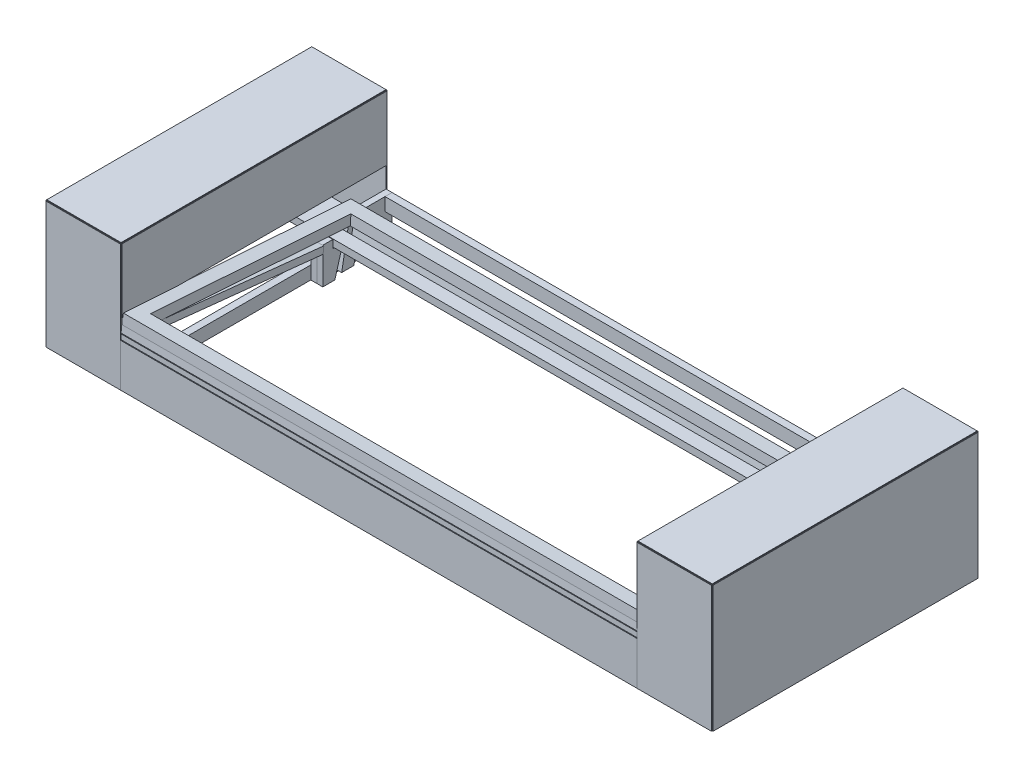
from build123d import *

# Parameters (mm, degrees)
SKETCH1_W              = 22.225
SKETCH1_H              = 41.275
BOSS_EXTRUDE1_DEPTH    = 838.2
SKETCH1_W_2            = 41.275
SKETCH1_H_2            = 22.225
BOSS_EXTRUDE1_2_DEPTH  = 838.2
BOSS_EXTRUDE1_3_DEPTH  = 838.2
BOSS_EXTRUDE1_4_DEPTH  = 838.2
BOSS_EXTRUDE1_5_DEPTH  = 838.2
BOSS_EXTRUDE1_6_DEPTH  = 838.2
BOSS_EXTRUDE1_7_DEPTH  = 838.2
SKETCH1_3_W            = 234.95
SKETCH1_3_H            = 2.54
EXTRUDE_THIN1_DEPTH    = 838.2
SKETCH1_4_W            = 2.54
SKETCH1_4_H            = 400.05
EXTRUDE_THIN2_DEPTH    = 838.2
SKETCH1_5_W            = 2.54
SKETCH1_5_H            = 203.2
EXTRUDE_THIN3_DEPTH    = 838.2
BOSS_EXTRUDE2_DEPTH    = 22.225
SKETCH3_W              = 74.6125
SKETCH3_H              = 41.275
BOSS_EXTRUDE3_DEPTH    = 22.225
BOSS_EXTRUDE3_2_DEPTH  = 22.225
BOSS_EXTRUDE3_3_DEPTH  = 22.225
BOSS_EXTRUDE3_4_DEPTH  = 22.225
SKETCH4_W              = 190.5
SKETCH4_H              = 111.125
BOSS_EXTRUDE4_DEPTH    = 22.225
BOSS_EXTRUDE4_2_DEPTH  = 22.225
EXTRUDE_THIN4_START    = -400.05
SKETCH4_3_W            = 234.95
SKETCH4_3_H            = 2.54
EXTRUDE_THIN4_DEPTH    = 400.05
SKETCH4_4_W            = 234.95
SKETCH4_4_H            = 2.54
EXTRUDE_THIN5_DEPTH    = 400.05
BOSS_EXTRUDE6_DEPTH    = 19.05
BOSS_EXTRUDE7_START    = 19.05
BOSS_EXTRUDE7_DEPTH    = 19.05
BOSS_EXTRUDE9_START    = 19.05
BOSS_EXTRUDE9_DEPTH    = 1597.025
SKETCH5_4_W            = 41.275
SKETCH5_4_H            = 22.225
BOSS_EXTRUDE9_2_DEPTH  = 1597.025
SKETCH5_4_W_2          = 22.225
SKETCH5_4_H_2          = 41.275
BOSS_EXTRUDE9_3_DEPTH  = 1597.025
BOSS_EXTRUDE9_4_DEPTH  = 1597.025
BOSS_EXTRUDE10_START   = 38.1
BOSS_EXTRUDE10_DEPTH   = 1558.925
BOSS_EXTRUDE11_DEPTH   = 1635.125
BOSS_EXTRUDE11_2_DEPTH = 1635.125
BOSS_EXTRUDE11_3_DEPTH = 1635.125
SKETCH5_8_W            = 22.225
SKETCH5_8_H            = 28.575
BOSS_EXTRUDE13_DEPTH   = 41.275
SKETCH5_9_W            = 2.54
SKETCH5_9_H            = 136.525
EXTRUDE_THIN6_DEPTH    = 1635.125
BOSS_EXTRUDE14_DEPTH   = 41.275
BOSS_EXTRUDE15_DEPTH   = 44.45
SKETCH7_W              = 1546.225
SKETCH7_H              = 44.45
BOSS_EXTRUDE16_DEPTH   = 31.824813128


with BuildPart() as part:
    # Sketch1 → Boss-Extrude1 (new body)
    with BuildSketch(Plane.XY):
        with Locations((-1041.4, 379.4125)):
            Rectangle(SKETCH1_W, SKETCH1_H)
    extrude(amount=BOSS_EXTRUDE1_DEPTH)


with BuildPart() as body_2:
    # Sketch1 → Boss-Extrude1 2 (new body)
    with BuildSketch(Plane.XY):
        with Locations((-935.0375, 388.9375)):
            Rectangle(SKETCH1_W_2, SKETCH1_H_2)
    extrude(amount=BOSS_EXTRUDE1_2_DEPTH)


with BuildPart() as body_3:
    # Sketch1 → Boss-Extrude1 3 (new body)
    with BuildSketch(Plane.XY):
        with Locations((-828.675, 379.4125)):
            Rectangle(SKETCH1_W, SKETCH1_H)
    extrude(amount=BOSS_EXTRUDE1_3_DEPTH)


with BuildPart() as body_4:
    # Sketch1 → Boss-Extrude1 4 (new body)
    with BuildSketch(Plane.XY):
        with Locations((-828.675, 207.9625)):
            Rectangle(SKETCH1_W, SKETCH1_H_2)
    extrude(amount=BOSS_EXTRUDE1_4_DEPTH)


with BuildPart() as body_5:
    # Sketch1 → Boss-Extrude1 5 (new body)
    with BuildSketch(Plane.XY):
        with Locations((-828.675, 20.6375)):
            Rectangle(SKETCH1_W, SKETCH1_H)
    extrude(amount=BOSS_EXTRUDE1_5_DEPTH)


with BuildPart() as body_6:
    # Sketch1 → Boss-Extrude1 6 (new body)
    with BuildSketch(Plane.XY):
        with Locations((-1041.4, 20.6375)):
            Rectangle(SKETCH1_W, SKETCH1_H)
    extrude(amount=BOSS_EXTRUDE1_6_DEPTH)


with BuildPart() as body_7:
    # Sketch1 → Boss-Extrude1 7 (new body)
    with BuildSketch(Plane.XY):
        with Locations((-1041.4, 207.9625)):
            Rectangle(SKETCH1_W, SKETCH1_H_2)
    extrude(amount=BOSS_EXTRUDE1_7_DEPTH)


with BuildPart() as body_8:
    # Sketch1<3> → Extrude-Thin1 (new body)
    with BuildSketch(Plane.XY):
        with Locations((-935.0375, 401.32)):
            Rectangle(SKETCH1_3_W, SKETCH1_3_H)
    extrude(amount=EXTRUDE_THIN1_DEPTH)


with BuildPart() as body_9:
    # Sketch1<4> → Extrude-Thin2 (new body)
    with BuildSketch(Plane.XY):
        with Locations((-1053.7825, 200.025)):
            Rectangle(SKETCH1_4_W, SKETCH1_4_H)
    extrude(amount=EXTRUDE_THIN2_DEPTH)


with BuildPart() as body_10:
    # Sketch1<5> → Extrude-Thin3 (new body)
    with BuildSketch(Plane.XY):
        with Locations((-816.2925, 298.45)):
            Rectangle(SKETCH1_5_W, SKETCH1_5_H)
    extrude(amount=EXTRUDE_THIN3_DEPTH)


with BuildPart() as body_11:
    # Sketch2 → Boss-Extrude2 (new body)
    with BuildSketch(Plane.ZY.offset(817.5625)):
        Polygon((0, 219.075), (139.7, 219.075), (95.25, 358.775), (0, 358.775), align=None)
    extrude(amount=BOSS_EXTRUDE2_DEPTH)


with BuildPart() as body_12:
    # Sketch3 → Boss-Extrude3 (new body)
    with BuildSketch(Plane.XZ.offset(-400.05)):
        with Locations((-877.09375, 261.9375)):
            Rectangle(SKETCH3_W, SKETCH3_H)
    extrude(amount=BOSS_EXTRUDE3_DEPTH)


with BuildPart() as body_13:
    # Sketch3 → Boss-Extrude3 2 (new body)
    with BuildSketch(Plane.XZ.offset(-400.05)):
        with Locations((-992.98125, 261.9375)):
            Rectangle(SKETCH3_W, SKETCH3_H)
    extrude(amount=BOSS_EXTRUDE3_2_DEPTH)


with BuildPart() as body_14:
    # Sketch3 → Boss-Extrude3 3 (new body)
    with BuildSketch(Plane.XZ.offset(-400.05)):
        with Locations((-877.09375, 604.8375)):
            Rectangle(SKETCH3_W, SKETCH3_H)
    extrude(amount=BOSS_EXTRUDE3_3_DEPTH)


with BuildPart() as body_15:
    # Sketch3 → Boss-Extrude3 4 (new body)
    with BuildSketch(Plane.XZ.offset(-400.05)):
        with Locations((-992.98125, 604.8375)):
            Rectangle(SKETCH3_W, SKETCH3_H)
    extrude(amount=BOSS_EXTRUDE3_4_DEPTH)


with BuildPart() as body_16:
    # Sketch4 → Boss-Extrude4 (new body)
    with BuildSketch(Plane.XZ):
        with Locations((-935.0375, 55.5625)):
            Rectangle(SKETCH4_W, SKETCH4_H)
    extrude(amount=-BOSS_EXTRUDE4_DEPTH)


with BuildPart() as body_17:
    # Sketch4 → Boss-Extrude4 2 (new body)
    with BuildSketch(Plane.XZ):
        with Locations((-935.0375, 782.6375)):
            Rectangle(SKETCH4_W, SKETCH4_H)
    extrude(amount=-BOSS_EXTRUDE4_2_DEPTH)


with BuildPart() as body_18:
    # Sketch4<3> → Extrude-Thin4 (new body)
    with BuildSketch(Plane.XZ.offset(EXTRUDE_THIN4_START)):
        with Locations((-935.0375, 839.47)):
            Rectangle(SKETCH4_3_W, SKETCH4_3_H)
    extrude(amount=EXTRUDE_THIN4_DEPTH)


with BuildPart() as body_19:
    # Sketch4<4> → Extrude-Thin5 (new body)
    with BuildSketch(Plane.XZ):
        with Locations((-935.0375, -1.27)):
            Rectangle(SKETCH4_4_W, SKETCH4_4_H)
    extrude(amount=-EXTRUDE_THIN5_DEPTH)


with BuildPart() as body_20:
    # Mirror Arm Geo: mirrored copy
    add(body_15.part.mirror(Plane(origin=(0, 0, 0), x_dir=(0, 0, 1), z_dir=(1, 0, 0))))


with BuildPart() as body_21:
    # Mirror Arm Geo 2: mirrored copy
    add(body_17.part.mirror(Plane(origin=(0, 0, 0), x_dir=(0, 0, 1), z_dir=(1, 0, 0))))


with BuildPart() as body_22:
    # Mirror Arm Geo 3: mirrored copy
    add(body_3.part.mirror(Plane(origin=(0, 0, 0), x_dir=(0, 0, 1), z_dir=(1, 0, 0))))


with BuildPart() as body_23:
    # Mirror Arm Geo 4: mirrored copy
    add(body_7.part.mirror(Plane(origin=(0, 0, 0), x_dir=(0, 0, 1), z_dir=(1, 0, 0))))


with BuildPart() as body_24:
    # Mirror Arm Geo 5: mirrored copy
    add(body_14.part.mirror(Plane(origin=(0, 0, 0), x_dir=(0, 0, 1), z_dir=(1, 0, 0))))


with BuildPart() as body_25:
    # Mirror Arm Geo 6: mirrored copy
    add(body_4.part.mirror(Plane(origin=(0, 0, 0), x_dir=(0, 0, 1), z_dir=(1, 0, 0))))


with BuildPart() as body_26:
    # Mirror Arm Geo 7: mirrored copy
    add(body_19.part.mirror(Plane(origin=(0, 0, 0), x_dir=(0, 0, 1), z_dir=(1, 0, 0))))


with BuildPart() as body_27:
    # Mirror Arm Geo 8: mirrored copy
    add(body_8.part.mirror(Plane(origin=(0, 0, 0), x_dir=(0, 0, 1), z_dir=(1, 0, 0))))


with BuildPart() as body_28:
    # Mirror Arm Geo 9: mirrored copy
    add(body_18.part.mirror(Plane(origin=(0, 0, 0), x_dir=(0, 0, 1), z_dir=(1, 0, 0))))


with BuildPart() as body_29:
    # Mirror Arm Geo 10: mirrored copy
    add(body_9.part.mirror(Plane(origin=(0, 0, 0), x_dir=(0, 0, 1), z_dir=(1, 0, 0))))


with BuildPart() as body_30:
    # Mirror Arm Geo 11: mirrored copy
    add(body_13.part.mirror(Plane(origin=(0, 0, 0), x_dir=(0, 0, 1), z_dir=(1, 0, 0))))


with BuildPart() as body_31:
    # Mirror Arm Geo 12: mirrored copy
    add(body_11.part.mirror(Plane(origin=(0, 0, 0), x_dir=(0, 0, 1), z_dir=(1, 0, 0))))


with BuildPart() as body_32:
    # Mirror Arm Geo 13: mirrored copy
    add(body_5.part.mirror(Plane(origin=(0, 0, 0), x_dir=(0, 0, 1), z_dir=(1, 0, 0))))


with BuildPart() as body_33:
    # Mirror Arm Geo 14: mirrored copy
    add(part.part.mirror(Plane(origin=(0, 0, 0), x_dir=(0, 0, 1), z_dir=(1, 0, 0))))


with BuildPart() as body_34:
    # Mirror Arm Geo 15: mirrored copy
    add(body_16.part.mirror(Plane(origin=(0, 0, 0), x_dir=(0, 0, 1), z_dir=(1, 0, 0))))


with BuildPart() as body_35:
    # Mirror Arm Geo 16: mirrored copy
    add(body_2.part.mirror(Plane(origin=(0, 0, 0), x_dir=(0, 0, 1), z_dir=(1, 0, 0))))


with BuildPart() as body_36:
    # Mirror Arm Geo 17: mirrored copy
    add(body_6.part.mirror(Plane(origin=(0, 0, 0), x_dir=(0, 0, 1), z_dir=(1, 0, 0))))


with BuildPart() as body_37:
    # Mirror Arm Geo 18: mirrored copy
    add(body_10.part.mirror(Plane(origin=(0, 0, 0), x_dir=(0, 0, 1), z_dir=(1, 0, 0))))


with BuildPart() as body_38:
    # Mirror Arm Geo 19: mirrored copy
    add(body_12.part.mirror(Plane(origin=(0, 0, 0), x_dir=(0, 0, 1), z_dir=(1, 0, 0))))


with BuildPart() as body_39:
    # Sketch5 → Boss-Extrude6 (new body)
    with BuildSketch(Plane(origin=(-817.5625, 0, 0), x_dir=(0, 0, -1), z_dir=(1, 0, 0))):
        Polygon((-113.187406715, 130.175), (-113.391643218, 127.201652684), (-156.678686158, 130.175), (-238.125, 130.175), (-238.125, 0), (0, 0), (0, 130.175), align=None)
    extrude(amount=BOSS_EXTRUDE6_DEPTH)


with BuildPart() as body_40:
    # Sketch5<3> → Boss-Extrude7 (new body)
    with BuildSketch(Plane(origin=(-817.5625, 0, 0), x_dir=(0, 0, -1), z_dir=(1, 0, 0)).offset(BOSS_EXTRUDE7_START)):
        Polygon((-188.232142857, 41.275), (-238.125, 41.275), (-238.125, 0), (-200.025, 0), align=None)
        Polygon((-206.375, 114.3), (-238.125, 114.3), (-238.125, 41.275), (-188.232142857, 41.275), (-174.625, 88.9), (-206.375, 88.9), align=None)
        Polygon((-141.055173379, 127.36048877), (-156.678686158, 130.175), (-163.542243628, 92.075), (-172.693653589, 41.275), (-133.980368774, 41.275), (-126.499984687, 82.799039825), (-148.372902576, 86.739355546), align=None)
        Polygon((-119.18225549, 123.420173049), (-141.055173379, 127.36048877), (-148.372902576, 86.739355546), (-126.499984687, 82.799039825), align=None)
        Polygon((-133.980368774, 41.275), (-172.693653589, 41.275), (-178.413284815, 9.525), (-139.7, 9.525), align=None)
    extrude(amount=BOSS_EXTRUDE7_DEPTH)


with BuildPart() as body_41:
    # Sketch5<4> → Boss-Extrude9 (new body)
    with BuildSketch(Plane(origin=(-817.5625, 0, 0), x_dir=(0, 0, -1), z_dir=(1, 0, 0)).offset(BOSS_EXTRUDE9_START)):
        Polygon((-79.375, 126.234684279), (-86.692729197, 85.613551055), (-108.565647087, 89.553866776), (-101.24791789, 130.175), align=None)
    extrude(amount=BOSS_EXTRUDE9_DEPTH)


with BuildPart() as body_42:
    # Sketch5<4> → Boss-Extrude9 2 (new body)
    with BuildSketch(Plane(origin=(-817.5625, 0, 0), x_dir=(0, 0, -1), z_dir=(1, 0, 0)).offset(BOSS_EXTRUDE9_START)):
        with Locations((-20.6375, 11.1125)):
            Rectangle(SKETCH5_4_W, SKETCH5_4_H)
    extrude(amount=BOSS_EXTRUDE9_2_DEPTH)


with BuildPart() as body_43:
    # Sketch5<4> → Boss-Extrude9 3 (new body)
    with BuildSketch(Plane(origin=(-817.5625, 0, 0), x_dir=(0, 0, -1), z_dir=(1, 0, 0)).offset(BOSS_EXTRUDE9_START)):
        with Locations((-11.1125, 109.5375)):
            Rectangle(SKETCH5_4_W_2, SKETCH5_4_H_2)
    extrude(amount=BOSS_EXTRUDE9_3_DEPTH)


with BuildPart() as body_44:
    # Sketch5<4> → Boss-Extrude9 4 (new body)
    with BuildSketch(Plane(origin=(-817.5625, 0, 0), x_dir=(0, 0, -1), z_dir=(1, 0, 0)).offset(BOSS_EXTRUDE9_START)):
        with Locations((-184.179743628, 103.1875)):
            Rectangle(SKETCH5_4_W, SKETCH5_4_H)
    extrude(amount=BOSS_EXTRUDE9_4_DEPTH)


with BuildPart() as body_45:
    # Sketch5<5> → Boss-Extrude10 (new body)
    with BuildSketch(Plane(origin=(-817.5625, 0, 0), x_dir=(0, 0, -1), z_dir=(1, 0, 0)).offset(BOSS_EXTRUDE10_START)):
        Polygon((-119.18225549, 123.420173049), (-141.055173379, 127.36048877), (-148.372902576, 86.739355546), (-126.499984687, 82.799039825), align=None)
    extrude(amount=BOSS_EXTRUDE10_DEPTH)


with BuildPart() as body_46:
    # Sketch5<7> → Boss-Extrude11 (new body)
    with BuildSketch(Plane(origin=(-817.5625, 0, 0), x_dir=(0, 0, -1), z_dir=(1, 0, 0))):
        Polygon((-838.2, 0), (-815.975, 0), (-815.975, 12.7), (-815.975, 41.275), (-838.2, 41.275), align=None)
    extrude(amount=BOSS_EXTRUDE11_DEPTH)


with BuildPart() as body_47:
    # Sketch5<7> → Boss-Extrude11 2 (new body)
    with BuildSketch(Plane(origin=(-817.5625, 0, 0), x_dir=(0, 0, -1), z_dir=(1, 0, 0))):
        Polygon((-815.975, 150.075143634), (-815.975, 152.4), (-838.2, 152.4), (-838.2, 136.525), (-838.2, 111.125), (-815.975, 111.125), align=None)
    extrude(amount=BOSS_EXTRUDE11_2_DEPTH)


with BuildPart() as body_48:
    # Sketch5<7> → Boss-Extrude11 3 (new body)
    with BuildSketch(Plane(origin=(-817.5625, 0, 0), x_dir=(0, 0, -1), z_dir=(1, 0, 0))):
        Polygon((-794.836745079, 172.535088611), (-835.887759831, 176.829248925), (-838.2, 154.724856366), (-815.975, 152.4), (-797.148985248, 150.430696052), align=None)
    extrude(amount=BOSS_EXTRUDE11_3_DEPTH)



with BuildPart() as body_49:
    # Sketch5<8> → Boss-Extrude13 (new body)
    with BuildSketch(Plane(origin=(-817.5625, 0, 0), x_dir=(0, 0, -1), z_dir=(1, 0, 0))):
        Polygon((-815.975, 41.275), (-793.75, 41.275), (-793.75, 150.075143634), (-815.975, 150.075143634), (-815.975, 111.125), align=None)
        with Locations((-804.8625, 26.9875)):
            Rectangle(SKETCH5_8_W, SKETCH5_8_H)
    extrude(amount=BOSS_EXTRUDE13_DEPTH)


with BuildPart() as body_50:
    # Sketch5<9> → Extrude-Thin6 (new body)
    with BuildSketch(Plane(origin=(-817.5625, 0, 0), x_dir=(0, 0, -1), z_dir=(1, 0, 0))):
        with Locations((-839.47, 68.2625)):
            Rectangle(SKETCH5_9_W, SKETCH5_9_H)
    extrude(amount=EXTRUDE_THIN6_DEPTH)


with BuildPart() as body_51:
    # Sketch5<10> → Boss-Extrude14 (new body)
    with BuildSketch(Plane(origin=(-817.5625, 0, 0), x_dir=(0, 0, -1), z_dir=(1, 0, 0))):
        Polygon((-240.437240169, 92.195607441), (-238.125, 114.3), (-794.836745079, 172.535088611), (-797.148985248, 150.430696052), (-793.75, 150.075143634), align=None)
    extrude(amount=BOSS_EXTRUDE14_DEPTH)


with BuildPart() as body_52:
    # Sketch5<11> → Boss-Extrude15 (new body)
    with BuildSketch(Plane(origin=(-817.5625, 0, 0), x_dir=(0, 0, -1), z_dir=(1, 0, 0))):
        Polygon((-835.887759831, 176.829248925), (-113.391643218, 127.201652684), (-111.21076481, 158.951652684), (-833.706881423, 208.579248925), align=None)
    extrude(amount=BOSS_EXTRUDE15_DEPTH)


with BuildPart() as body_53:
    # Mirror2: mirrored copy
    add(body_40.part.mirror(Plane(origin=(0, 0, 0), x_dir=(0, 0, 1), z_dir=(1, 0, 0))))


with BuildPart() as body_54:
    # Mirror2 2: mirrored copy
    add(body_39.part.mirror(Plane(origin=(0, 0, 0), x_dir=(0, 0, 1), z_dir=(1, 0, 0))))


with BuildPart() as body_55:
    # Mirror2 3: mirrored copy
    add(body_49.part.mirror(Plane(origin=(0, 0, 0), x_dir=(0, 0, 1), z_dir=(1, 0, 0))))


with BuildPart() as body_56:
    # Mirror2 4: mirrored copy
    add(body_51.part.mirror(Plane(origin=(0, 0, 0), x_dir=(0, 0, 1), z_dir=(1, 0, 0))))


with BuildPart() as body_57:
    # Mirror2 5: mirrored copy
    add(body_52.part.mirror(Plane(origin=(0, 0, 0), x_dir=(0, 0, 1), z_dir=(1, 0, 0))))


with BuildPart() as body_48_1:
    add(body_48.part)

    add(body_52.part)  # Boss-Extrude16 merges body 52

    add(body_57.part)  # Boss-Extrude16 merges body 57
    # Sketch7 → Boss-Extrude16 (add)
    with BuildSketch(Plane(origin=(0, 150.60211771, -10.344721472), x_dir=(1, 0, 0), z_dir=(0, 0.9976492201955747, -0.06852761080879625))):
        with Locations((0, -823.815457717)):
            Rectangle(SKETCH7_W, SKETCH7_H)
        with Locations((0, -144.066909782)):
            Rectangle(SKETCH7_W, SKETCH7_H)
    extrude(amount=-BOSS_EXTRUDE16_DEPTH)


solid = Compound([part.part, body_2.part, body_3.part, body_4.part, body_5.part, body_6.part, body_7.part, body_8.part, body_9.part, body_10.part, body_11.part, body_12.part, body_13.part, body_14.part, body_15.part, body_16.part, body_17.part, body_18.part, body_19.part, body_20.part, body_21.part, body_22.part, body_23.part, body_24.part, body_25.part, body_26.part, body_27.part, body_28.part, body_29.part, body_30.part, body_31.part, body_32.part, body_33.part, body_34.part, body_35.part, body_36.part, body_37.part, body_38.part, body_39.part, body_40.part, body_41.part, body_42.part, body_43.part, body_44.part, body_45.part, body_46.part, body_47.part, body_49.part, body_50.part, body_51.part, body_53.part, body_54.part, body_55.part, body_56.part, body_48_1.part])
